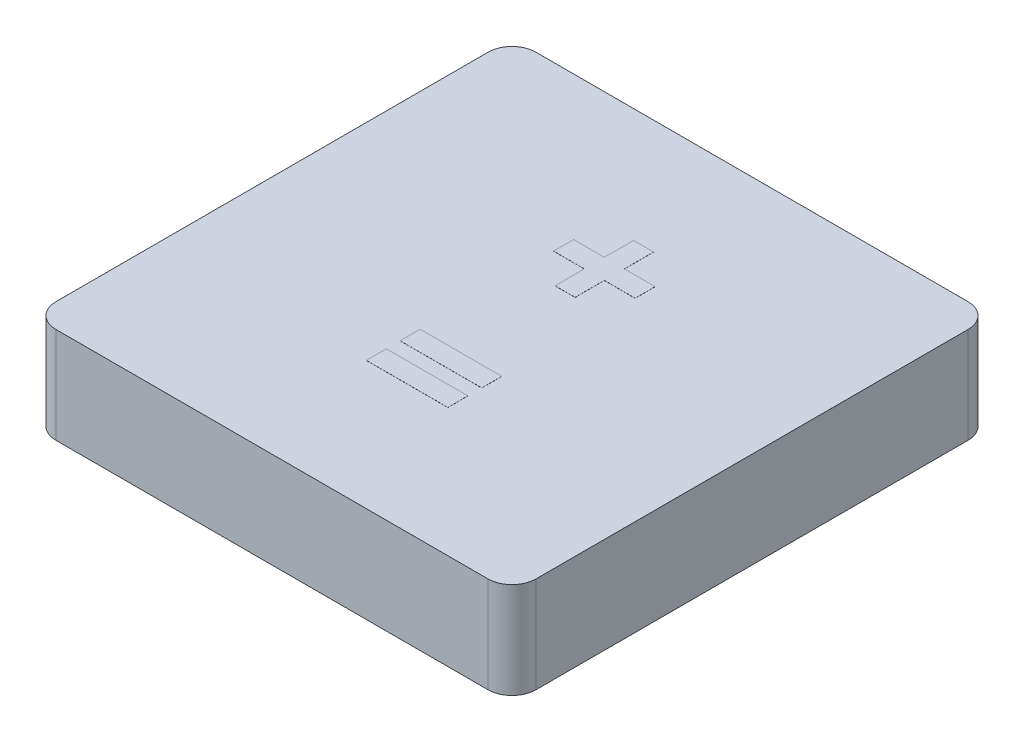
from build123d import *

# Parameters (mm, degrees)
SKETCH1_W           = 12.7
SKETCH1_H           = 12.7
BOSS_EXTRUDE1_DEPTH = 2.54
FILLET1_R           = 0.635
SHELL1_START        = 0.635
SHELL1_OUTLINE_W    = 1.905
SHELL1_OUTLINE_H    = 11.43
SHELL1_DEPTH        = 11.43
SKETCH2_R           = 2.54
BOSS_EXTRUDE2_DEPTH = 1.905
SKETCH3_W           = 2.157371795
SKETCH3_H           = 0.529166666
SKETCH3_H_2         = 0.529166667
BOSS_EXTRUDE3_DEPTH = 0.00254


# Read off the part's stored shape, not the designer's step: Shell1
with BuildPart() as part:
    # Sketch1 → Boss-Extrude1 (new body)
    with BuildSketch(Plane(origin=(0, 0, 0), x_dir=(1, 0, 0), z_dir=(0, 1, 0))):
        with Locations((6.35, 6.35)):
            Rectangle(SKETCH1_W, SKETCH1_H)
    extrude(amount=BOSS_EXTRUDE1_DEPTH)

    # Fillet1
    fillet1_edges = [part.edges().sort_by_distance(p)[0] for p in [
        (0, 1.27, -12.7),
        (12.7, 1.27, -12.7),
        (12.7, 1.27, 0),
        (0, 1.27, 0),
    ]]
    fillet(fillet1_edges, radius=FILLET1_R)

    # Shell1 outline → Shell1 (cut)
    with BuildSketch(Plane.YZ.offset(SHELL1_START)):
        with Locations((0.9525, -6.35)):
            Rectangle(SHELL1_OUTLINE_W, SHELL1_OUTLINE_H)
    extrude(amount=SHELL1_DEPTH, mode=Mode.SUBTRACT)

    # Sketch2 → Boss-Extrude2 (add)
    with BuildSketch(Plane(origin=(0, 1.905, 0), x_dir=(-1, 0, 0), z_dir=(0, -1, 0))):
        with Locations(Location((-6.35, 6.35, 0), (0, 0, 270))):
            Circle(SKETCH2_R)
    extrude(amount=BOSS_EXTRUDE2_DEPTH)

    # Sketch3 → Boss-Extrude3 (add)
    with BuildSketch(Plane(origin=(0, 2.54, 0), x_dir=(1, 0, 0), z_dir=(0, 1, 0))):
        Polygon((6.239933333, 8.903025641), (6.239933333, 9.676423077), (6.7691, 9.676423077), (6.7691, 8.903025641), (7.583202564, 8.903025641), (7.583202564, 8.373858974), (6.7691, 8.373858974), (6.7691, 7.600461538), (6.239933333, 7.600461538), (6.239933333, 8.373858974), (5.425830769, 8.373858974), (5.425830769, 8.903025641), align=None)
        with Locations((6.529916667, 4.554903846)):
            Rectangle(SKETCH3_W, SKETCH3_H)
        with Locations((6.529916667, 3.659391026)):
            Rectangle(SKETCH3_W, SKETCH3_H_2)
    extrude(amount=BOSS_EXTRUDE3_DEPTH)


solid = part.part
